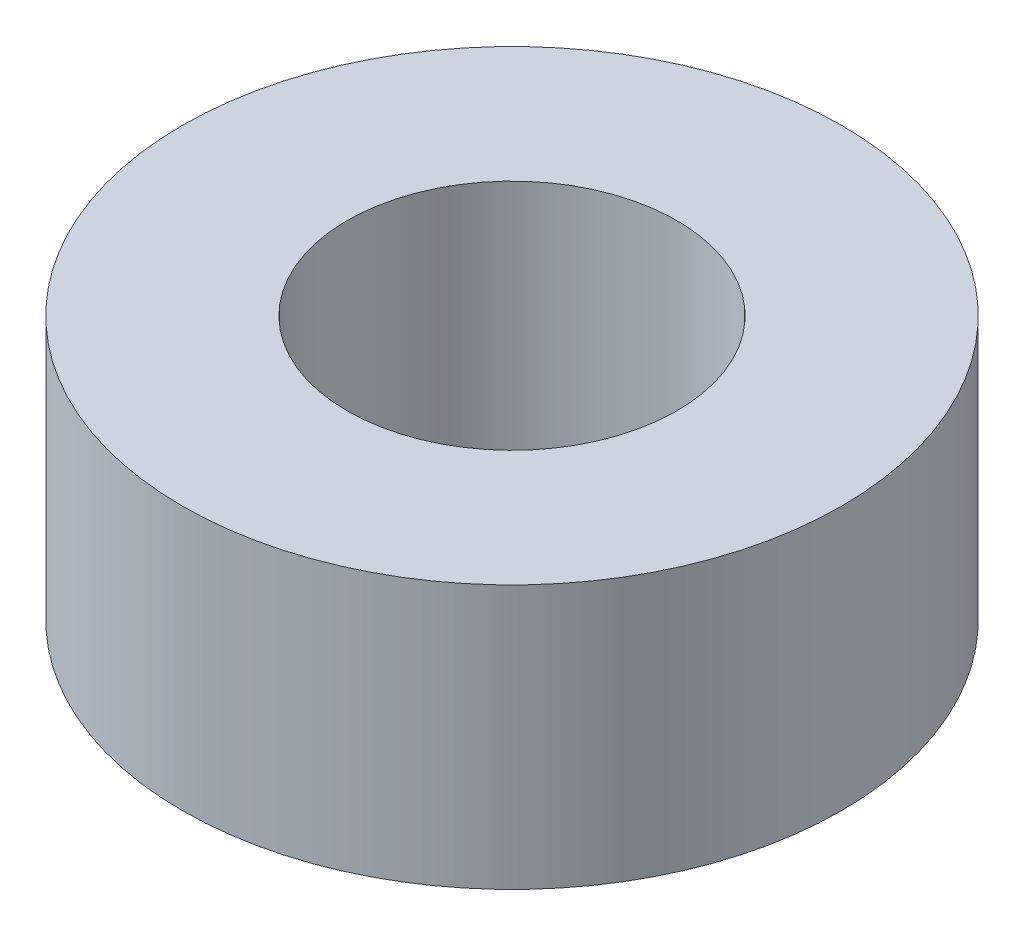
from build123d import *

# Parameters (mm, degrees)
SKETCH1_R           = 20
BOSS_EXTRUDE1_DEPTH = 16
SKETCH2_R           = 10
CUT_EXTRUDE1_DEPTH  = 33.496153619


with BuildPart() as part:
    # Sketch1 → Boss-Extrude1 (new body)
    with BuildSketch(Plane(origin=(0, 0, 0), x_dir=(1, 0, 0), z_dir=(0, 1, 0))):
        Circle(SKETCH1_R)
    extrude(amount=BOSS_EXTRUDE1_DEPTH)

    # Sketch2 → Cut-Extrude1 (cut, through all)
    with BuildSketch(Plane(origin=(0, 0, 0), x_dir=(1, 0, 0), z_dir=(0, 1, 0))):
        Circle(SKETCH2_R)
    extrude(amount=CUT_EXTRUDE1_DEPTH, mode=Mode.SUBTRACT)


solid = part.part
